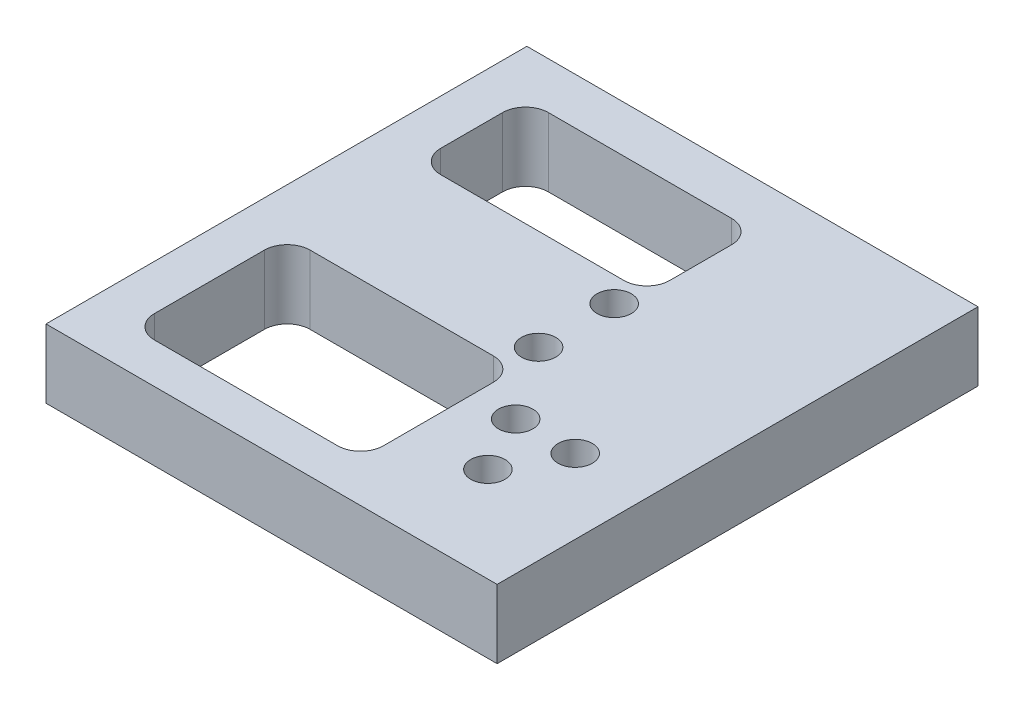
from build123d import *

# Parameters (mm, degrees)
SKETCH1_W           = 197
SKETCH1_H           = 210
BOSS_EXTRUDE1_DEPTH = 30
CUT_EXTRUDE2_REACH  = 149.062
SKETCH3_R           = 7.5
SKETCH4_R           = 9
CUT_EXTRUDE3_DEPTH  = 5


with BuildPart() as part:
    # Sketch1 → Boss-Extrude1 (new body)
    with BuildSketch(Plane(origin=(0, 0, 0), x_dir=(1, 0, 0), z_dir=(0, 1, 0))):
        Rectangle(SKETCH1_W, SKETCH1_H)
    extrude(amount=-BOSS_EXTRUDE1_DEPTH)

    # Sketch3 → Cut-Extrude2 (cut, up to next)
    with BuildSketch(Plane(origin=(0, 0, 0), x_dir=(1, 0, 0), z_dir=(0, 1, 0)), mode=Mode.PRIVATE) as cut_extrude2_sk1:
        with Locations((17.88, 26.73)):
            Circle(SKETCH3_R)
    cut_extrude2_tool1 = extrude(cut_extrude2_sk1.sketch, amount=-CUT_EXTRUDE2_REACH, mode=Mode.PRIVATE) & part.part
    # Sketch3 → Cut-Extrude2 (cut, up to next)
    with BuildSketch(Plane(origin=(0, 0, 0), x_dir=(1, 0, 0), z_dir=(0, 1, 0)), mode=Mode.PRIVATE) as cut_extrude2_sk2:
        with Locations((17.88, -6.27)):
            Circle(SKETCH3_R)
    cut_extrude2_tool2 = extrude(cut_extrude2_sk2.sketch, amount=-CUT_EXTRUDE2_REACH, mode=Mode.PRIVATE) & part.part
    # Sketch3 → Cut-Extrude2 (cut, up to next)
    with BuildSketch(Plane(origin=(0, 0, 0), x_dir=(1, 0, 0), z_dir=(0, 1, 0)), mode=Mode.PRIVATE) as cut_extrude2_sk3:
        with Locations((53, -63.53)):
            Circle(SKETCH3_R)
    cut_extrude2_tool3 = extrude(cut_extrude2_sk3.sketch, amount=-CUT_EXTRUDE2_REACH, mode=Mode.PRIVATE) & part.part
    # Sketch3 → Cut-Extrude2 (cut, up to next)
    with BuildSketch(Plane(origin=(0, 0, 0), x_dir=(1, 0, 0), z_dir=(0, 1, 0)), mode=Mode.PRIVATE) as cut_extrude2_sk4:
        with Locations((66, -38.4)):
            Circle(SKETCH3_R)
    cut_extrude2_tool4 = extrude(cut_extrude2_sk4.sketch, amount=-CUT_EXTRUDE2_REACH, mode=Mode.PRIVATE) & part.part
    # Sketch3 → Cut-Extrude2 (cut, up to next)
    with BuildSketch(Plane(origin=(0, 0, 0), x_dir=(1, 0, 0), z_dir=(0, 1, 0)), mode=Mode.PRIVATE) as cut_extrude2_sk5:
        with Locations((40, -38.4)):
            Circle(SKETCH3_R)
    cut_extrude2_tool5 = extrude(cut_extrude2_sk5.sketch, amount=-CUT_EXTRUDE2_REACH, mode=Mode.PRIVATE) & part.part
    # Sketch3 → Cut-Extrude2 (cut, up to next)
    with BuildSketch(Plane(origin=(0, 0, 0), x_dir=(1, 0, 0), z_dir=(0, 1, 0)), mode=Mode.PRIVATE) as cut_extrude2_sk6:
        with BuildLine():
            Line((-68.745, 84.63), (11.255, 84.63))
            ThreePointArc((11.255, 84.63), (18.326067812, 81.701067812), (21.255, 74.63))
            Line((21.255, 74.63), (21.255, 47.63))
            ThreePointArc((21.255, 47.63), (18.326067812, 40.558932188), (11.255, 37.63))
            Line((11.255, 37.63), (-68.745, 37.63))
            ThreePointArc((-68.745, 37.63), (-75.816067812, 40.558932188), (-78.745, 47.63))
            Line((-78.745, 47.63), (-78.745, 74.63))
            ThreePointArc((-78.745, 74.63), (-75.816067812, 81.701067812), (-68.745, 84.63))
        make_face()
    cut_extrude2_tool6 = extrude(cut_extrude2_sk6.sketch, amount=-CUT_EXTRUDE2_REACH, mode=Mode.PRIVATE) & part.part
    # Sketch3 → Cut-Extrude2 (cut, up to next)
    with BuildSketch(Plane(origin=(0, 0, 0), x_dir=(1, 0, 0), z_dir=(0, 1, 0)), mode=Mode.PRIVATE) as cut_extrude2_sk7:
        with BuildLine():
            Line((-68.745, -19.4), (11.255, -19.4))
            ThreePointArc((11.255, -19.4), (18.326067812, -22.328932188), (21.255, -29.4))
            Line((21.255, -29.4), (21.255, -77.4))
            ThreePointArc((21.255, -77.4), (18.326067812, -84.471067812), (11.255, -87.4))
            Line((11.255, -87.4), (-68.745, -87.4))
            ThreePointArc((-68.745, -87.4), (-75.816067812, -84.471067812), (-78.745, -77.4))
            Line((-78.745, -77.4), (-78.745, -29.4))
            ThreePointArc((-78.745, -29.4), (-75.816067812, -22.328932188), (-68.745, -19.4))
        make_face()
    cut_extrude2_tool7 = extrude(cut_extrude2_sk7.sketch, amount=-CUT_EXTRUDE2_REACH, mode=Mode.PRIVATE) & part.part
    add(cut_extrude2_tool1.solids().sort_by_distance((17.88, 0, -26.73))[0], mode=Mode.SUBTRACT)
    add(cut_extrude2_tool2.solids().sort_by_distance((17.88, 0, 6.27))[0], mode=Mode.SUBTRACT)
    add(cut_extrude2_tool3.solids().sort_by_distance((53, 0, 63.53))[0], mode=Mode.SUBTRACT)
    add(cut_extrude2_tool4.solids().sort_by_distance((66, 0, 38.4))[0], mode=Mode.SUBTRACT)
    add(cut_extrude2_tool5.solids().sort_by_distance((40, 0, 38.4))[0], mode=Mode.SUBTRACT)
    add(cut_extrude2_tool6.solids().sort_by_distance((-28.745, 0, -61.13))[0], mode=Mode.SUBTRACT)
    add(cut_extrude2_tool7.solids().sort_by_distance((-28.745, 0, 53.4))[0], mode=Mode.SUBTRACT)

    # Sketch4 → Cut-Extrude3 (cut)
    with BuildSketch(Plane.XZ.offset(30)):
        with Locations((17.88, -26.73)):
            Circle(SKETCH4_R)
        with Locations((17.88, 6.27)):
            Circle(SKETCH4_R)
        with Locations((40, 38.4)):
            Circle(SKETCH4_R)
        with Locations((66, 38.4)):
            Circle(SKETCH4_R)
        with Locations((53, 63.53)):
            Circle(SKETCH4_R)
    extrude(amount=-CUT_EXTRUDE3_DEPTH, mode=Mode.SUBTRACT)


solid = part.part
